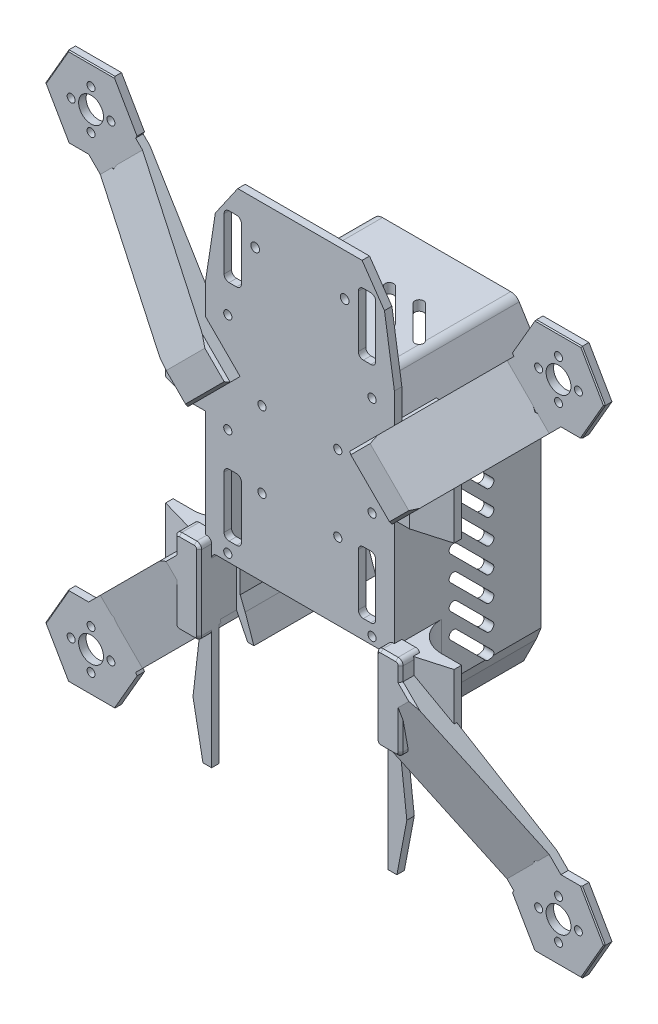
from build123d import *

# Parameters (mm, degrees)
EXTRUDE_297_DEPTH           = 3
F_4MM_START                 = -56
F_4MM_DEPTH                 = 56
EXTRUDE_START               = -56
EXTRUDE_1_1_DEPTH           = 11
EXTRUDE_1_1_2_DEPTH         = 11
EXTRUDE_1_1_3_DEPTH         = 11
EXTRUDE_1_1_4_DEPTH         = 11
CUT_EXTRUDE_START           = -56
SKETCH_97_R                 = 1.25
CUT_EXTRUDE_M3_8_DEPTH      = 8
XT30_DEPTH                  = 3
EXTRUDE_1_DEPTH             = 56
CUT_EXTRUDE_1_DEPTH         = 56
EXTRUDE_1_2_DEPTH           = 56
CUT_EXTRUDE_1788_DEPTH      = 56
FILLET_R2_R                 = 2
FILLET_R4_R                 = 4
SKETCH_113_W                = 100
SKETCH_113_H                = 58
CUT_EXTRUDE_2237_DEPTH      = 12
CUT_EXTRUDE_START_2         = -7
CUT_EXTRUDE_2463_DEPTH      = 17
SKETCH_115_R                = 1.65
CUT_EXTRUDE_M3_DEPTH        = 3
SKETCH_116_R                = 1.65
CUT_EXTRUDE_M3_2_DEPTH      = 3
CUT_EXTRUDE_45_DEPTH        = 80
CUT_EXTRUDE_45_DEPTH_BACK   = 80
CUT_EXTRUDE_45_2_DEPTH      = 12
CUT_EXTRUDE_45_2_DEPTH_BACK = 12
CUT_EXTRUDE_45_2_START      = 60
F_10MM_0_1_START            = 12
F_10MM_0_1_DEPTH            = 24
F_10MM_0_1_START_2          = -12
F_10MM_0_1_2_DEPTH          = 24
F_10MM_1_1_START            = 12
F_10MM_1_1_DEPTH            = 24
F_10MM_1_1_START_2          = -12
F_10MM_1_1_2_DEPTH          = 24
EXTRUDE_1_3_DEPTH           = 8
EXTRUDE_1_4_DEPTH           = 8
CUT_EXTRUDE_3927_DEPTH      = 19
EXTRUDE_START_2             = -10
EXTRUDE_1_1_5_DEPTH         = 3
EXTRUDE_1_1_6_DEPTH         = 3
EXTRUDE_1_1_7_DEPTH         = 3
EXTRUDE_1_1_8_DEPTH         = 3
CUT_EXTRUDE_4744_DEPTH      = 20
CUT_EXTRUDE_START_3         = -14
SKETCH_131_R                = 5
SKETCH_131_R_2              = 1.6
CUT_EXTRUDE_4917_DEPTH      = 12
SKETCH_132_R                = 1.65
CUT_EXTRUDE_M3_3_DEPTH      = 3
SKETCH_133_R                = 1.75
CUT_EXTRUDE_5145_DEPTH      = 3
CUT_EXTRUDE_START_4         = -3
SKETCH_134_R                = 3.6
CUT_EXTRUDE_5236_DEPTH      = 3
EXTRUDE_START_3             = -54
EXTRUDE_R12_1_1_DEPTH       = 32
EXTRUDE_START_4             = 22
EXTRUDE_R12_1_1_2_DEPTH     = 32
EXTRUDE_R12_1_1_3_DEPTH     = 32
EXTRUDE_R12_1_1_4_DEPTH     = 32
C0P4_SIZE                   = 0.4
CHAMFER_C1_SIZE             = 1


with BuildPart() as part:
    # 草图73 → Extrude 297 (new body)
    with BuildSketch(Plane.XY):
        Polygon((0, -118), (25, -114), (39, -101), (43, -80), (40, -54), (38, -32), (38, 67), (34, 93), (25, 106), (-25, 106), (-34, 93), (-38, 67), (-38, -32), (-40, -54), (-43, -80), (-39, -101), (-25, -114), align=None)
    extrude(amount=EXTRUDE_297_DEPTH)

    # 草图85 → 机舱侧壁后壁与脊顶一体_4mm (add)
    with BuildSketch(Plane.XY.offset(F_4MM_START)):
        Polygon((-38, -60), (-38, 50), (-28, 66), (28, 66), (38, 50), (38, -60), (34, -60), (34, 48), (26, 62), (-26, 62), (-34, 48), (-34, -60), align=None)
    extrude(amount=F_4MM_DEPTH)

    # 草图89 → Extrude 1_-1 (add)
    with BuildSketch(Plane.XY.offset(EXTRUDE_START)):
        with BuildLine():
            Line((-36.5, -47.5), (-33, -47.5))
            ThreePointArc((-33, -47.5), (-31.939339828, -47.060660172), (-31.5, -46))
            Line((-31.5, -46), (-31.5, -40))
            ThreePointArc((-31.5, -40), (-31.939339828, -38.939339828), (-33, -38.5))
            Line((-33, -38.5), (-36.5, -38.5))
            ThreePointArc((-36.5, -38.5), (-37.560660172, -38.939339828), (-38, -40))
            Line((-38, -40), (-38, -46))
            ThreePointArc((-38, -46), (-37.560660172, -47.060660172), (-36.5, -47.5))
        make_face()
    extrude(amount=EXTRUDE_1_1_DEPTH)

    # 草图91 → Extrude 1_1 2 (add)
    with BuildSketch(Plane.XY.offset(EXTRUDE_START)):
        with BuildLine():
            Line((-36.5, 38.5), (-33, 38.5))
            ThreePointArc((-33, 38.5), (-31.939339828, 38.939339828), (-31.5, 40))
            Line((-31.5, 40), (-31.5, 46))
            ThreePointArc((-31.5, 46), (-31.939339828, 47.060660172), (-33, 47.5))
            Line((-33, 47.5), (-36.5, 47.5))
            ThreePointArc((-36.5, 47.5), (-37.560660172, 47.060660172), (-38, 46))
            Line((-38, 46), (-38, 40))
            ThreePointArc((-38, 40), (-37.560660172, 38.939339828), (-36.5, 38.5))
        make_face()
    extrude(amount=EXTRUDE_1_1_2_DEPTH)

    # 草图93 → Extrude 1_-1 3 (add)
    with BuildSketch(Plane.XY.offset(EXTRUDE_START)):
        with BuildLine():
            Line((33, -47.5), (36.5, -47.5))
            ThreePointArc((36.5, -47.5), (37.560660172, -47.060660172), (38, -46))
            Line((38, -46), (38, -40))
            ThreePointArc((38, -40), (37.560660172, -38.939339828), (36.5, -38.5))
            Line((36.5, -38.5), (33, -38.5))
            ThreePointArc((33, -38.5), (31.939339828, -38.939339828), (31.5, -40))
            Line((31.5, -40), (31.5, -46))
            ThreePointArc((31.5, -46), (31.939339828, -47.060660172), (33, -47.5))
        make_face()
    extrude(amount=EXTRUDE_1_1_3_DEPTH)

    # 草图95 → Extrude 1_1 4 (add)
    with BuildSketch(Plane.XY.offset(EXTRUDE_START)):
        with BuildLine():
            Line((33, 38.5), (36.5, 38.5))
            ThreePointArc((36.5, 38.5), (37.560660172, 38.939339828), (38, 40))
            Line((38, 40), (38, 46))
            ThreePointArc((38, 46), (37.560660172, 47.060660172), (36.5, 47.5))
            Line((36.5, 47.5), (33, 47.5))
            ThreePointArc((33, 47.5), (31.939339828, 47.060660172), (31.5, 46))
            Line((31.5, 46), (31.5, 40))
            ThreePointArc((31.5, 40), (31.939339828, 38.939339828), (33, 38.5))
        make_face()
    extrude(amount=EXTRUDE_1_1_4_DEPTH)

    # 草图97 → 检修盖四M3螺纹底孔_深8 (cut)
    with BuildSketch(Plane.XY.offset(CUT_EXTRUDE_START)):
        with Locations((-34, -43)):
            Circle(SKETCH_97_R)
        with Locations((-34, 43)):
            Circle(SKETCH_97_R)
        with Locations((34, -43)):
            Circle(SKETCH_97_R)
        with Locations((34, 43)):
            Circle(SKETCH_97_R)
    extrude(amount=CUT_EXTRUDE_M3_8_DEPTH, mode=Mode.SUBTRACT)

    # 草图100 → 顶面扎带_导轨_XT30绝缘座孔 (cut)
    with BuildSketch(Plane.XY):
        with BuildLine():
            Line((-28.5, -18.5), (-25.5, -18.5))
            ThreePointArc((-25.5, -18.5), (-24.085786438, -17.914213562), (-23.5, -16.5))
            Line((-23.5, -16.5), (-23.5, 4.5))
            ThreePointArc((-23.5, 4.5), (-24.085786438, 5.914213562), (-25.5, 6.5))
            Line((-25.5, 6.5), (-28.5, 6.5))
            ThreePointArc((-28.5, 6.5), (-29.914213562, 5.914213562), (-30.5, 4.5))
            Line((-30.5, 4.5), (-30.5, -16.5))
            ThreePointArc((-30.5, -16.5), (-29.914213562, -17.914213562), (-28.5, -18.5))
        make_face()
        with BuildLine():
            Line((-28.5, 71.5), (-25.5, 71.5))
            ThreePointArc((-25.5, 71.5), (-24.085786438, 72.085786438), (-23.5, 73.5))
            Line((-23.5, 73.5), (-23.5, 94.5))
            ThreePointArc((-23.5, 94.5), (-24.085786438, 95.914213562), (-25.5, 96.5))
            Line((-25.5, 96.5), (-28.5, 96.5))
            ThreePointArc((-28.5, 96.5), (-29.914213562, 95.914213562), (-30.5, 94.5))
            Line((-30.5, 94.5), (-30.5, 73.5))
            ThreePointArc((-30.5, 73.5), (-29.914213562, 72.085786438), (-28.5, 71.5))
        make_face()
        with BuildLine():
            Line((25.5, -18.5), (28.5, -18.5))
            ThreePointArc((28.5, -18.5), (29.914213562, -17.914213562), (30.5, -16.5))
            Line((30.5, -16.5), (30.5, 4.5))
            ThreePointArc((30.5, 4.5), (29.914213562, 5.914213562), (28.5, 6.5))
            Line((28.5, 6.5), (25.5, 6.5))
            ThreePointArc((25.5, 6.5), (24.085786438, 5.914213562), (23.5, 4.5))
            Line((23.5, 4.5), (23.5, -16.5))
            ThreePointArc((23.5, -16.5), (24.085786438, -17.914213562), (25.5, -18.5))
        make_face()
        with BuildLine():
            Line((25.5, 71.5), (28.5, 71.5))
            ThreePointArc((28.5, 71.5), (29.914213562, 72.085786438), (30.5, 73.5))
            Line((30.5, 73.5), (30.5, 94.5))
            ThreePointArc((30.5, 94.5), (29.914213562, 95.914213562), (28.5, 96.5))
            Line((28.5, 96.5), (25.5, 96.5))
            ThreePointArc((25.5, 96.5), (24.085786438, 95.914213562), (23.5, 94.5))
            Line((23.5, 94.5), (23.5, 73.5))
            ThreePointArc((23.5, 73.5), (24.085786438, 72.085786438), (25.5, 71.5))
        make_face()
    extrude(amount=XT30_DEPTH, mode=Mode.SUBTRACT)

    # 草图106 → Extrude 1 (add)
    with BuildSketch(Plane.XY.offset(EXTRUDE_START)):
        Polygon((-31, -60), (-36, -50), (-38, -45), (-34, -45), (-32, -50), (-28.5, -60), align=None)
    extrude(amount=EXTRUDE_1_DEPTH)

    # 草图107 → 机头侧壁斜切_-1 (cut)
    with BuildSketch(Plane.XY.offset(CUT_EXTRUDE_START)):
        Polygon((-31, -60), (-36, -50), (-38, -45), (-43, -45), (-43, -63), (-31, -63), align=None)
    extrude(amount=CUT_EXTRUDE_1_DEPTH, mode=Mode.SUBTRACT)

    # 草图108 → Extrude 1 2 (add)
    with BuildSketch(Plane.XY.offset(EXTRUDE_START)):
        Polygon((31, -60), (36, -50), (38, -45), (34, -45), (32, -50), (28.5, -60), align=None)
    extrude(amount=EXTRUDE_1_2_DEPTH)

    # 草图109 → Cut-Extrude 1788 (cut)
    with BuildSketch(Plane.XY.offset(CUT_EXTRUDE_START)):
        Polygon((31, -60), (36, -50), (38, -45), (43, -45), (43, -63), (31, -63), align=None)
    extrude(amount=CUT_EXTRUDE_1788_DEPTH, mode=Mode.SUBTRACT)

    # 尾舱内角R2刀具过渡
    fillet_r2_edges = [part.edges().sort_by_distance(p)[0] for p in [
        (-26, 62, -28),
        (26, 62, -28),
    ]]
    fillet(fillet_r2_edges, radius=FILLET_R2_R)

    # 尾舱外角R4流线过渡
    fillet_r4_edges = [part.edges().sort_by_distance(p)[0] for p in [
        (28, 66, -28),
        (-28, 66, -28),
    ]]
    fillet(fillet_r4_edges, radius=FILLET_R4_R)

    # 草图113 → Cut-Extrude 2237 (cut)
    with BuildSketch(Plane.XY):
        with Locations((0, -130)):
            Rectangle(SKETCH_113_W, SKETCH_113_H)
    extrude(amount=CUT_EXTRUDE_2237_DEPTH, mode=Mode.SUBTRACT)

    # 草图114 → Cut-Extrude 2463 (cut)
    with BuildSketch(Plane.XY.offset(CUT_EXTRUDE_START_2)):
        with BuildLine():
            Line((-33.5, -104), (33.5, -104))
            ThreePointArc((33.5, -104), (34.914213562, -103.414213562), (35.5, -102))
            Line((35.5, -102), (35.5, -28))
            ThreePointArc((35.5, -28), (34.914213562, -26.585786438), (33.5, -26))
            Line((33.5, -26), (-33.5, -26))
            ThreePointArc((-33.5, -26), (-34.914213562, -26.585786438), (-35.5, -28))
            Line((-35.5, -28), (-35.5, -102))
            ThreePointArc((-35.5, -102), (-34.914213562, -103.414213562), (-33.5, -104))
        make_face()
    extrude(amount=CUT_EXTRUDE_2463_DEPTH, mode=Mode.SUBTRACT)

    # 草图115 → Cut-Extrude M3 (cut)
    with BuildSketch(Plane.XY):
        with Locations((-15.25, 4.75)):
            Circle(SKETCH_115_R)
        with Locations((-15.25, 35.25)):
            Circle(SKETCH_115_R)
        with Locations((15.25, 4.75)):
            Circle(SKETCH_115_R)
        with Locations((15.25, 35.25)):
            Circle(SKETCH_115_R)
    extrude(amount=CUT_EXTRUDE_M3_DEPTH, mode=Mode.SUBTRACT)

    # 草图116 → Cut-Extrude M3 2 (cut)
    with BuildSketch(Plane.XY):
        with Locations((-29, -23)):
            Circle(SKETCH_116_R)
        with Locations((29, -23)):
            Circle(SKETCH_116_R)
    extrude(amount=CUT_EXTRUDE_M3_2_DEPTH, mode=Mode.SUBTRACT)

    # 草图117 → Cut-Extrude 45 (cut, two sides: drawn at the far end of the back side and taken through both)
    with BuildSketch(Plane(origin=(0, 0, 0), x_dir=(0, 0, -1), z_dir=(1, 0, 0)).offset(-CUT_EXTRUDE_45_DEPTH_BACK)):
        with BuildLine():
            Line((36.485281374, -43.01040764), (21.98959236, -28.514718626))
            ThreePointArc((21.98959236, -28.514718626), (19.514718626, -28.514718626), (19.514718626, -30.98959236))
            Line((19.514718626, -30.98959236), (34.01040764, -45.485281374))
            ThreePointArc((34.01040764, -45.485281374), (36.485281374, -45.485281374), (36.485281374, -43.01040764))
        make_face()
        with BuildLine():
            Line((36.485281374, -33.01040764), (21.98959236, -18.514718626))
            ThreePointArc((21.98959236, -18.514718626), (19.514718626, -18.514718626), (19.514718626, -20.98959236))
            Line((19.514718626, -20.98959236), (34.01040764, -35.485281374))
            ThreePointArc((34.01040764, -35.485281374), (36.485281374, -35.485281374), (36.485281374, -33.01040764))
        make_face()
        with BuildLine():
            Line((36.485281374, -23.01040764), (21.98959236, -8.514718626))
            ThreePointArc((21.98959236, -8.514718626), (19.514718626, -8.514718626), (19.514718626, -10.98959236))
            Line((19.514718626, -10.98959236), (34.01040764, -25.485281374))
            ThreePointArc((34.01040764, -25.485281374), (36.485281374, -25.485281374), (36.485281374, -23.01040764))
        make_face()
        with BuildLine():
            Line((36.485281374, -13.01040764), (21.98959236, 1.485281374))
            ThreePointArc((21.98959236, 1.485281374), (19.514718626, 1.485281374), (19.514718626, -0.98959236))
            Line((19.514718626, -0.98959236), (34.01040764, -15.485281374))
            ThreePointArc((34.01040764, -15.485281374), (36.485281374, -15.485281374), (36.485281374, -13.01040764))
        make_face()
        with BuildLine():
            Line((36.485281374, -3.01040764), (21.98959236, 11.485281374))
            ThreePointArc((21.98959236, 11.485281374), (19.514718626, 11.485281374), (19.514718626, 9.01040764))
            Line((19.514718626, 9.01040764), (34.01040764, -5.485281374))
            ThreePointArc((34.01040764, -5.485281374), (36.485281374, -5.485281374), (36.485281374, -3.01040764))
        make_face()
        with BuildLine():
            Line((36.485281374, 6.98959236), (21.98959236, 21.485281374))
            ThreePointArc((21.98959236, 21.485281374), (19.514718626, 21.485281374), (19.514718626, 19.01040764))
            Line((19.514718626, 19.01040764), (34.01040764, 4.514718626))
            ThreePointArc((34.01040764, 4.514718626), (36.485281374, 4.514718626), (36.485281374, 6.98959236))
        make_face()
        with BuildLine():
            Line((36.485281374, 16.98959236), (21.98959236, 31.485281374))
            ThreePointArc((21.98959236, 31.485281374), (19.514718626, 31.485281374), (19.514718626, 29.01040764))
            Line((19.514718626, 29.01040764), (34.01040764, 14.514718626))
            ThreePointArc((34.01040764, 14.514718626), (36.485281374, 14.514718626), (36.485281374, 16.98959236))
        make_face()
        with BuildLine():
            Line((36.485281374, 26.98959236), (21.98959236, 41.485281374))
            ThreePointArc((21.98959236, 41.485281374), (19.514718626, 41.485281374), (19.514718626, 39.01040764))
            Line((19.514718626, 39.01040764), (34.01040764, 24.514718626))
            ThreePointArc((34.01040764, 24.514718626), (36.485281374, 24.514718626), (36.485281374, 26.98959236))
        make_face()
        with BuildLine():
            Line((36.485281374, 36.98959236), (21.98959236, 51.485281374))
            ThreePointArc((21.98959236, 51.485281374), (19.514718626, 51.485281374), (19.514718626, 49.01040764))
            Line((19.514718626, 49.01040764), (34.01040764, 34.514718626))
            ThreePointArc((34.01040764, 34.514718626), (36.485281374, 34.514718626), (36.485281374, 36.98959236))
        make_face()
    extrude(amount=CUT_EXTRUDE_45_DEPTH + CUT_EXTRUDE_45_DEPTH_BACK, mode=Mode.SUBTRACT)

    # 草图118 → Cut-Extrude 45 2 (cut, two sides: drawn at the far end of the back side and taken through both)
    with BuildSketch(Plane(origin=(0, 0, 0), x_dir=(1, 0, 0), z_dir=(0, 1, 0)).offset(CUT_EXTRUDE_45_2_START - CUT_EXTRUDE_45_2_DEPTH_BACK)):
        with BuildLine():
            Line((-23.303300859, 34.778174593), (-10.221825407, 21.696699141))
            ThreePointArc((-10.221825407, 21.696699141), (-10.221825407, 19.221825407), (-12.696699141, 19.221825407))
            Line((-12.696699141, 19.221825407), (-25.778174593, 32.303300859))
            ThreePointArc((-25.778174593, 32.303300859), (-25.778174593, 34.778174593), (-23.303300859, 34.778174593))
        make_face()
        with BuildLine():
            Line((-11.303300859, 34.778174593), (1.778174593, 21.696699141))
            ThreePointArc((1.778174593, 21.696699141), (1.778174593, 19.221825407), (-0.696699141, 19.221825407))
            Line((-0.696699141, 19.221825407), (-13.778174593, 32.303300859))
            ThreePointArc((-13.778174593, 32.303300859), (-13.778174593, 34.778174593), (-11.303300859, 34.778174593))
        make_face()
        with BuildLine():
            Line((0.696699141, 34.778174593), (13.778174593, 21.696699141))
            ThreePointArc((13.778174593, 21.696699141), (13.778174593, 19.221825407), (11.303300859, 19.221825407))
            Line((11.303300859, 19.221825407), (-1.778174593, 32.303300859))
            ThreePointArc((-1.778174593, 32.303300859), (-1.778174593, 34.778174593), (0.696699141, 34.778174593))
        make_face()
        with BuildLine():
            Line((12.696699141, 34.778174593), (25.778174593, 21.696699141))
            ThreePointArc((25.778174593, 21.696699141), (25.778174593, 19.221825407), (23.303300859, 19.221825407))
            Line((23.303300859, 19.221825407), (10.221825407, 32.303300859))
            ThreePointArc((10.221825407, 32.303300859), (10.221825407, 34.778174593), (12.696699141, 34.778174593))
        make_face()
    extrude(amount=CUT_EXTRUDE_45_2_DEPTH + CUT_EXTRUDE_45_2_DEPTH_BACK, mode=Mode.SUBTRACT)

    # 草图119 → 10mm__0_-1 (add)
    with BuildSketch(Plane(origin=(0, 0, 0), x_dir=(0, 0, 1), z_dir=(-0.7071067811865476, 0.7071067811865476, 0)).offset(F_10MM_0_1_START)):
        Polygon((0, -46), (0, -58), (-10, -115.656854249), (-10, -133.656854249), (-7, -133.656854249), (-7, -115.656854249), (8, -58), (8, -46), align=None)
    extrude(amount=-F_10MM_0_1_DEPTH)

    # 草图120 → 10mm__0_1 2 (add)
    with BuildSketch(Plane(origin=(0, 0, 0), x_dir=(0, 0, 1), z_dir=(-0.7071067811865476, 0.7071067811865476, 0)).offset(F_10MM_0_1_START_2)):
        Polygon((0, 46), (0, 58), (-10, 115.656854249), (-10, 133.656854249), (-7, 133.656854249), (-7, 115.656854249), (8, 58), (8, 46), align=None)
    extrude(amount=F_10MM_0_1_2_DEPTH)

    # 草图121 → 10mm__1_-1 (add)
    with BuildSketch(Plane(origin=(0, 0, 0), x_dir=(0, 0, 1), z_dir=(-0.7071067811865476, -0.7071067811865475, 0)).offset(F_10MM_1_1_START)):
        Polygon((0, 46), (0, 58), (-10, 115.656854249), (-10, 133.656854249), (-7, 133.656854249), (-7, 115.656854249), (8, 58), (8, 46), align=None)
    extrude(amount=-F_10MM_1_1_DEPTH)

    # 草图122 → 10mm__1_1 2 (add)
    with BuildSketch(Plane(origin=(0, 0, 0), x_dir=(0, 0, 1), z_dir=(-0.7071067811865476, -0.7071067811865475, 0)).offset(F_10MM_1_1_START_2)):
        Polygon((0, -46), (0, -58), (-10, -115.656854249), (-10, -133.656854249), (-7, -133.656854249), (-7, -115.656854249), (8, -58), (8, -46), align=None)
    extrude(amount=F_10MM_1_1_2_DEPTH)

    # 草图123 → Extrude 1 3 (add)
    with BuildSketch(Plane.XY):
        with BuildLine():
            Line((-43.5, -55), (-37.5, -55))
            ThreePointArc((-37.5, -55), (-36.085786438, -54.414213562), (-35.5, -53))
            Line((-35.5, -53), (-35.5, -23))
            ThreePointArc((-35.5, -23), (-36.085786438, -21.585786438), (-37.5, -21))
            Line((-37.5, -21), (-43.5, -21))
            ThreePointArc((-43.5, -21), (-44.914213562, -21.585786438), (-45.5, -23))
            Line((-45.5, -23), (-45.5, -53))
            ThreePointArc((-45.5, -53), (-44.914213562, -54.414213562), (-43.5, -55))
        make_face()
    extrude(amount=EXTRUDE_1_3_DEPTH)

    # 草图124 → Extrude 1 4 (add)
    with BuildSketch(Plane.XY):
        with BuildLine():
            Line((37.5, -55), (43.5, -55))
            ThreePointArc((43.5, -55), (44.914213562, -54.414213562), (45.5, -53))
            Line((45.5, -53), (45.5, -23))
            ThreePointArc((45.5, -23), (44.914213562, -21.585786438), (43.5, -21))
            Line((43.5, -21), (37.5, -21))
            ThreePointArc((37.5, -21), (36.085786438, -21.585786438), (35.5, -23))
            Line((35.5, -23), (35.5, -53))
            ThreePointArc((35.5, -53), (36.085786438, -54.414213562), (37.5, -55))
        make_face()
    extrude(amount=EXTRUDE_1_4_DEPTH)

    # 草图125 → Cut-Extrude 3927 (cut)
    with BuildSketch(Plane.XY.offset(CUT_EXTRUDE_START_2)):
        with BuildLine():
            Line((-33.5, -104), (33.5, -104))
            ThreePointArc((33.5, -104), (34.914213562, -103.414213562), (35.5, -102))
            Line((35.5, -102), (35.5, -28))
            ThreePointArc((35.5, -28), (34.914213562, -26.585786438), (33.5, -26))
            Line((33.5, -26), (-33.5, -26))
            ThreePointArc((-33.5, -26), (-34.914213562, -26.585786438), (-35.5, -28))
            Line((-35.5, -28), (-35.5, -102))
            ThreePointArc((-35.5, -102), (-34.914213562, -103.414213562), (-33.5, -104))
        make_face()
    extrude(amount=CUT_EXTRUDE_3927_DEPTH, mode=Mode.SUBTRACT)

    # 草图126 → Extrude 1_-1 5 (add)
    with BuildSketch(Plane.XY.offset(EXTRUDE_START_2)):
        Polygon((-75.5, -94), (-84.75, -77.97853003), (-103.25, -77.97853003), (-112.5, -94), (-103.25, -110.02146997), (-84.75, -110.02146997), align=None)
    extrude(amount=EXTRUDE_1_1_5_DEPTH)

    # 草图127 → Extrude 1_1 6 (add)
    with BuildSketch(Plane.XY.offset(EXTRUDE_START_2)):
        Polygon((-75.5, 94), (-84.75, 110.02146997), (-103.25, 110.02146997), (-112.5, 94), (-103.25, 77.97853003), (-84.75, 77.97853003), align=None)
    extrude(amount=EXTRUDE_1_1_6_DEPTH)

    # 草图128 → Extrude 1_-1 7 (add)
    with BuildSketch(Plane.XY.offset(EXTRUDE_START_2)):
        Polygon((112.5, -94), (103.25, -77.97853003), (84.75, -77.97853003), (75.5, -94), (84.75, -110.02146997), (103.25, -110.02146997), align=None)
    extrude(amount=EXTRUDE_1_1_7_DEPTH)

    # 草图129 → Extrude 1_1 8 (add)
    with BuildSketch(Plane.XY.offset(EXTRUDE_START_2)):
        Polygon((112.5, 94), (103.25, 110.02146997), (84.75, 110.02146997), (75.5, 94), (84.75, 77.97853003), (103.25, 77.97853003), align=None)
    extrude(amount=EXTRUDE_1_1_8_DEPTH)

    # 草图130 → Cut-Extrude 4744 (cut)
    with BuildSketch(Plane.XY.offset(CUT_EXTRUDE_START_2)):
        Polygon((-75.5, -94), (-84.75, -77.97853003), (-103.25, -77.97853003), (-112.5, -94), (-103.25, -110.02146997), (-84.75, -110.02146997), align=None)
        Polygon((-75.5, 94), (-84.75, 110.02146997), (-103.25, 110.02146997), (-112.5, 94), (-103.25, 77.97853003), (-84.75, 77.97853003), align=None)
        Polygon((112.5, -94), (103.25, -77.97853003), (84.75, -77.97853003), (75.5, -94), (84.75, -110.02146997), (103.25, -110.02146997), align=None)
        Polygon((112.5, 94), (103.25, 110.02146997), (84.75, 110.02146997), (75.5, 94), (84.75, 77.97853003), (103.25, 77.97853003), align=None)
    extrude(amount=CUT_EXTRUDE_4744_DEPTH, mode=Mode.SUBTRACT)

    # 草图131 → Cut-Extrude 4917 (cut)
    with BuildSketch(Plane.XY.offset(CUT_EXTRUDE_START_3)):
        with Locations(Location((-94, -94, 0), (0, 0, 180))):
            Circle(SKETCH_131_R)
        with Locations(Location((-102, -94, 0), (0, 0, 180))):
            Circle(SKETCH_131_R_2)
        with Locations(Location((-94, -102, 0), (0, 0, 180))):
            Circle(SKETCH_131_R_2)
        with Locations(Location((-86, -94, 0), (0, 0, 180))):
            Circle(SKETCH_131_R_2)
        with Locations(Location((-94, -86, 0), (0, 0, 180))):
            Circle(SKETCH_131_R_2)
        with Locations(Location((-94, 94, 0), (0, 0, 180))):
            Circle(SKETCH_131_R)
        with Locations(Location((-102, 94, 0), (0, 0, 180))):
            Circle(SKETCH_131_R_2)
        with Locations(Location((-94, 86, 0), (0, 0, 180))):
            Circle(SKETCH_131_R_2)
        with Locations(Location((-86, 94, 0), (0, 0, 180))):
            Circle(SKETCH_131_R_2)
        with Locations(Location((-94, 102, 0), (0, 0, 180))):
            Circle(SKETCH_131_R_2)
        with Locations(Location((94, -94, 0), (0, 0, 180))):
            Circle(SKETCH_131_R)
        with Locations(Location((86, -94, 0), (0, 0, 180))):
            Circle(SKETCH_131_R_2)
        with Locations(Location((94, -102, 0), (0, 0, 180))):
            Circle(SKETCH_131_R_2)
        with Locations(Location((102, -94, 0), (0, 0, 180))):
            Circle(SKETCH_131_R_2)
        with Locations(Location((94, -86, 0), (0, 0, 180))):
            Circle(SKETCH_131_R_2)
        with Locations(Location((94, 94, 0), (0, 0, 180))):
            Circle(SKETCH_131_R)
        with Locations(Location((86, 94, 0), (0, 0, 180))):
            Circle(SKETCH_131_R_2)
        with Locations(Location((94, 86, 0), (0, 0, 180))):
            Circle(SKETCH_131_R_2)
        with Locations(Location((102, 94, 0), (0, 0, 180))):
            Circle(SKETCH_131_R_2)
        with Locations(Location((94, 102, 0), (0, 0, 180))):
            Circle(SKETCH_131_R_2)
    extrude(amount=CUT_EXTRUDE_4917_DEPTH, mode=Mode.SUBTRACT)

    # 草图132 → Cut-Extrude M3 3 (cut)
    with BuildSketch(Plane.XY):
        with Locations((-29, 20)):
            Circle(SKETCH_132_R)
        with Locations(Location((-29, 60, 0), (0, 0, 318.008428976))):
            Circle(SKETCH_132_R)
        with Locations((29, 20)):
            Circle(SKETCH_132_R)
        with Locations(Location((29, 60, 0), (0, 0, 197.49819157))):
            Circle(SKETCH_132_R)
    extrude(amount=CUT_EXTRUDE_M3_3_DEPTH, mode=Mode.SUBTRACT)

    # 草图133 → Cut-Extrude 5145 (cut)
    with BuildSketch(Plane.XY):
        with Locations((-18, 89)):
            Circle(SKETCH_133_R)
        with Locations((18, 89)):
            Circle(SKETCH_133_R)
    extrude(amount=CUT_EXTRUDE_5145_DEPTH, mode=Mode.SUBTRACT)

    # 草图134 → Cut-Extrude 5236 (cut)
    with BuildSketch(Plane.XY.offset(CUT_EXTRUDE_START_4)):
        with Locations((-29, 60)):
            Circle(SKETCH_134_R)
        with Locations((29, 60)):
            Circle(SKETCH_134_R)
    extrude(amount=CUT_EXTRUDE_5236_DEPTH, mode=Mode.SUBTRACT)

    # 草图136 → Extrude R12_-1_-1 (add)
    with BuildSketch(Plane(origin=(0, 0, 0), x_dir=(1, 0, 0), z_dir=(0, 1, 0)).offset(EXTRUDE_START_3)):
        with BuildLine():
            Line((-44, -3), (-35.8, -3))
            Line((-35.8, -3), (-35.8, 16))
            Line((-35.8, 16), (-38, 16))
            ThreePointArc((-38, 16), (-41.514718626, 7.514718626), (-50, 4))
            Line((-50, 4), (-58, 4))
            Line((-58, 4), (-58, 1))
            Line((-58, 1), (-44, -3))
        make_face()
    extrude(amount=EXTRUDE_R12_1_1_DEPTH)

    # 草图137 → Extrude R12_-1_1 2 (add)
    with BuildSketch(Plane(origin=(0, 0, 0), x_dir=(1, 0, 0), z_dir=(0, 1, 0)).offset(EXTRUDE_START_4)):
        with BuildLine():
            Line((-35.8, -3), (-44, -3))
            Line((-44, -3), (-58, 1))
            Line((-58, 1), (-58, 4))
            Line((-58, 4), (-50, 4))
            ThreePointArc((-50, 4), (-41.514718626, 7.514718626), (-38, 16))
            Line((-38, 16), (-35.8, 16))
            Line((-35.8, 16), (-35.8, -3))
        make_face()
    extrude(amount=EXTRUDE_R12_1_1_2_DEPTH)

    # 草图138 → Extrude R12_1_-1 3 (add)
    with BuildSketch(Plane(origin=(0, 0, 0), x_dir=(1, 0, 0), z_dir=(0, 1, 0)).offset(EXTRUDE_START_3)):
        with BuildLine():
            Line((35.8, -3), (44, -3))
            Line((44, -3), (58, 1))
            Line((58, 1), (58, 4))
            Line((58, 4), (50, 4))
            ThreePointArc((50, 4), (41.514718626, 7.514718626), (38, 16))
            Line((38, 16), (35.8, 16))
            Line((35.8, 16), (35.8, -3))
        make_face()
    extrude(amount=EXTRUDE_R12_1_1_3_DEPTH)

    # 草图139 → Extrude R12_1_1 4 (add)
    with BuildSketch(Plane(origin=(0, 0, 0), x_dir=(1, 0, 0), z_dir=(0, 1, 0)).offset(EXTRUDE_START_4)):
        with BuildLine():
            Line((35.8, -3), (44, -3))
            Line((44, -3), (58, 1))
            Line((58, 1), (58, 4))
            Line((58, 4), (50, 4))
            ThreePointArc((50, 4), (41.514718626, 7.514718626), (38, 16))
            Line((38, 16), (35.8, 16))
            Line((35.8, 16), (35.8, -3))
        make_face()
    extrude(amount=EXTRUDE_R12_1_1_4_DEPTH)

    # 六边形电机台外缘倒角_C0p4
    c0p4_edges = [part.edges().sort_by_distance(p)[0] for p in [
        (-107.875, -85.989265015, -7),
        (-107.875, -102.010734985, -7),
        (-94, -110.02146997, -7),
        (-94, 110.02146997, -7),
        (-107.875, 102.010734985, -7),
        (-107.875, 85.989265015, -7),
        (94, -110.02146997, -7),
        (107.875, -102.010734985, -7),
        (107.875, -85.989265015, -7),
        (107.875, 85.989265015, -7),
        (107.875, 102.010734985, -7),
        (94, 110.02146997, -7),
    ]]
    chamfer(c0p4_edges, length=C0P4_SIZE)

    # 四机臂根部整边倒角_C1
    chamfer_c1_edges = [part.edges().sort_by_distance(p)[0] for p in [
        (-47.498737342, -30.528174593, 8),
        (28.284271247, 45.254833996, 8),
        (45.254833996, 28.284271247, 8),
        (32.526911935, 32.526911935, 8),
        (-28.284271247, 45.254833996, 8),
        (-32.526911935, 32.526911935, 8),
        (-45.254833996, 28.284271247, 8),
        (47.498737342, -30.528174593, 8),
        (-45.5, -44.762193309, 8),
        (-44.914213562, -54.414213562, 8),
        (-40.5, -55, 8),
        (-36.085786438, -54.414213562, 8),
        (-35.5, -38, 8),
        (-36.085786438, -21.585786438, 8),
        (-40.5, -21, 8),
        (-44.914213562, -21.585786438, 8),
        (-45.5, -25.764718626, 8),
        (35.5, -38, 8),
        (36.085786438, -54.414213562, 8),
        (40.5, -55, 8),
        (44.914213562, -54.414213562, 8),
        (45.5, -44.762193309, 8),
        (45.5, -25.764718626, 8),
        (44.914213562, -21.585786438, 8),
        (40.5, -21, 8),
        (36.085786438, -21.585786438, 8),
    ]]
    chamfer(chamfer_c1_edges, length=CHAMFER_C1_SIZE)


solid = part.part
